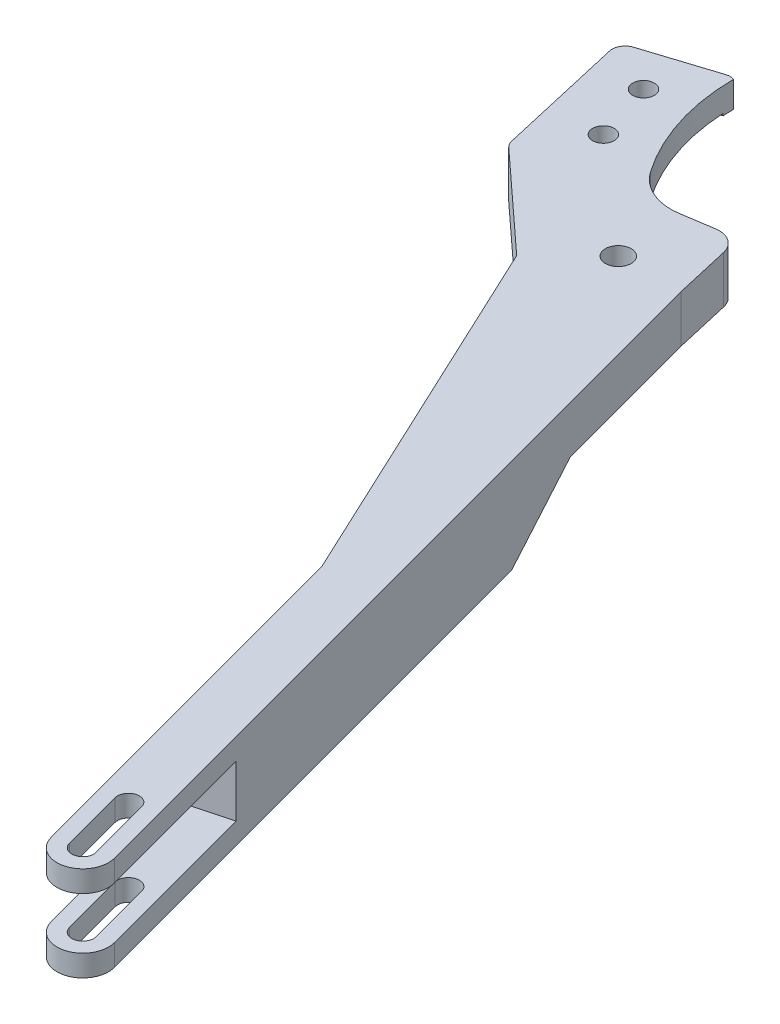
from build123d import *
from build123d.topology import SkipClean

# Parameters (mm, degrees)
SKETCH1_R              = 2.5
SKETCH1_R_2            = 3
BOSS_EXTRUDE1_DEPTH    = 11
BOSS_EXTRUDE2_START    = 11
BOSS_EXTRUDE2_DEPTH    = 11
CUT_EXTRUDE8_START     = -5.42
CUT_EXTRUDE8_OUTLINE_R = 2.5
CUT_EXTRUDE8_DEPTH     = 5.42
CUT_EXTRUDE9_DEPTH     = 200.464537277
SKETCH22_W             = 1.692224542
SKETCH22_H             = 1
BOSS_EXTRUDE5_DEPTH    = 5.58
BOSS_EXTRUDE6_START    = 0.5
BOSS_EXTRUDE6_DEPTH    = 0.5
CUT_EXTRUDE11_START    = -5
CUT_EXTRUDE11_DEPTH    = 12
CUT_EXTRUDE12_DEPTH    = 11


# Read off the part's stored shape, not the designer's step: Cut-Extrude8
with BuildPart() as part:
    # Sketch1 → Boss-Extrude1 (new body)
    with BuildSketch(Plane(origin=(0, 0, 0), x_dir=(1, 0, 0), z_dir=(0, 1, 0))):
        with BuildLine():
            Line((-24.065911245, 49.074379963), (-40.33748217, 43.862823975))
            ThreePointArc((-40.33748217, 43.862823975), (-42.029254381, 42.490505115), (-42.346540309, 40.335352706))
            Line((-42.346540309, 40.335352706), (-35.554744394, 10.712738062))
            ThreePointArc((-35.554744394, 10.712738062), (-35.224207157, 9.875429138), (-34.660148596, 9.173874408))
            Line((-34.660148596, 9.173874408), (-11.926083617, -11.710336344))
            Line((-11.926083617, -11.710336344), (28.105920068, -97.151333217))
            Line((28.105920068, -97.151333217), (51.127586716, -183.069362819))
            ThreePointArc((51.127586716, -183.069362819), (58.476055497, -187.312004338), (62.718696966, -179.963535528))
            Line((62.718696966, -179.963535528), (14.478423579, 0.071615722))
            Line((14.478423579, 0.071615722), (11.515517153, 12.994417934))
            ThreePointArc((11.515517153, 12.994417934), (9.45213952, 16.012597514), (5.886229377, 16.819579599))
            Line((5.886229377, 16.819579599), (-1.513417826, 15.688133083))
            ThreePointArc((-1.513417826, 15.688133083), (-8.06952351, 16.520767077), (-13.198183321, 20.688818137))
            ThreePointArc((-13.198183321, 20.688818137), (-19.873214701, 34.19205636), (-22.223775344, 49.070508937))
            ThreePointArc((-22.223775344, 49.070508937), (-23.144538818, 49.217338163), (-24.065911245, 49.074379963))
        make_face()
        with BuildLine():
            ThreePointArc((59.386252708, -180.856460648), (57.583130416, -183.97956007), (54.460030994, -182.176437778))
            Line((54.460030994, -182.176437778), (50.577745318, -167.687550384))
            ThreePointArc((50.577745318, -167.687550384), (52.38086761, -164.564450962), (55.503967032, -166.367573254))
            Line((55.503967032, -166.367573254), (59.386252708, -180.856460648))
        make_face(mode=Mode.SUBTRACT)
        with Locations(Location((-26.231262377, 22.76176979, 0), (0, 0, 270))):
            Circle(SKETCH1_R, mode=Mode.SUBTRACT)
        with BuildLine():
            Line((-32.594396249, 32.813795701), (-31.813835797, 32.992760568))
            ThreePointArc((-31.813835797, 32.992760568), (-32.198538906, 32.878953378), (-32.594396249, 32.813795701))
        make_face(mode=Mode.SUBTRACT)
        with Locations(Location((-30.69116896, 36.558843149, 0), (0, 0, 270))):
            Circle(SKETCH1_R, mode=Mode.SUBTRACT)
        with Locations(Location((0, 0, 0), (0, 0, 270))):
            Circle(SKETCH1_R_2, mode=Mode.SUBTRACT)
    extrude(amount=BOSS_EXTRUDE1_DEPTH)

    # Sketch15 → Boss-Extrude2 (add)
    with SkipClean():  # the faces are left unmerged after this step: merging them gives an invalid solid
        with BuildSketch(Plane.XZ.offset(BOSS_EXTRUDE2_START)):
            with BuildLine():
                ThreePointArc((62.718696809, 179.963534942), (60.986991622, 177.102253359), (57.992587901, 175.612528046))
                Line((57.992587901, 175.612528046), (55.514643215, 166.364712579))
                ThreePointArc((55.514643215, 166.364712579), (52.378006935, 164.553774778), (50.567069134, 167.690411058))
                Line((50.567069134, 167.690411058), (53.04501382, 176.938226526))
                ThreePointArc((53.04501382, 176.938226526), (51.196646785, 179.725568352), (51.127586894, 183.069363484))
                Line((51.127586894, 183.069363484), (28.105920068, 97.151333217))
                Line((28.105920068, 97.151333217), (12.304730128, 38.18048954))
                Line((12.304730128, 38.18048954), (23.895840044, 35.074660999))
                Line((23.895840044, 35.074660999), (62.718696809, 179.963534942))
            make_face()
            with BuildLine():
                ThreePointArc((54.449354811, 182.179298453), (57.585991091, 183.990236254), (59.396928892, 180.853599973))
                Line((59.396928892, 180.853599973), (57.992587901, 175.612528046))
                ThreePointArc((57.992587901, 175.612528046), (60.986991622, 177.102253359), (62.718696809, 179.963534942))
                ThreePointArc((62.718696809, 179.963534942), (62.87181102, 180.73329206), (62.923141851, 181.516449213))
                ThreePointArc((62.923141851, 181.516449213), (57.706299005, 187.465118381), (51.127586894, 183.069363484))
                ThreePointArc((51.127586894, 183.069363484), (51.196646785, 179.725568352), (53.04501382, 176.938226526))
                Line((53.04501382, 176.938226526), (54.449354811, 182.179298453))
            make_face()
        extrude(amount=-BOSS_EXTRUDE2_DEPTH)

    # Cut-Extrude8 outline → Cut-Extrude8 (cut)
    with SkipClean():  # the faces are left unmerged after this step: merging them gives an invalid solid
        with BuildSketch(Plane.XZ.offset(CUT_EXTRUDE8_START)):
            with BuildLine():
                Line((7.440475273, -16.812852061), (5.096097174, -11.765824195))
                ThreePointArc((5.096097174, -11.765824195), (0.648562626, -11.588913559), (-3.406606041, -13.423979773))
                Line((-3.406606041, -13.423979773), (-22.492177879, -12.118359456))
                ThreePointArc((-22.492177879, -12.118359456), (-26.84408445, -13.271868588), (-29.593378831, -16.837125174))
                Line((-29.593378831, -16.837125174), (-38.983226386, -44.296573112))
                Line((-38.983226386, -44.296573112), (-24.065911245, -49.074379963))
                ThreePointArc((-24.065911245, -49.074379963), (-23.144538818, -49.217338163), (-22.223775344, -49.070508937))
                ThreePointArc((-22.223775344, -49.070508937), (-19.873214666, -34.19205625), (-13.198183188, -20.688817948))
                ThreePointArc((-13.198183188, -20.688817948), (-8.069523818, -16.520767209), (-1.513418717, -15.688132947))
                Line((-1.513418717, -15.688132947), (5.886229377, -16.819579599))
                ThreePointArc((5.886229377, -16.819579599), (6.663615332, -16.876977606), (7.440475273, -16.812852061))
            make_face()
            with Locations((-30.69116896, -36.558843149)):
                Circle(CUT_EXTRUDE8_OUTLINE_R, mode=Mode.SUBTRACT)
            with BuildLine():
                Line((-31.813835797, -32.992760568), (-32.594396249, -32.813795701))
                ThreePointArc((-32.594396249, -32.813795701), (-32.198538906, -32.878953378), (-31.813835797, -32.992760568))
            make_face(mode=Mode.SUBTRACT)
            with Locations((-26.231262377, -22.76176979)):
                Circle(CUT_EXTRUDE8_OUTLINE_R, mode=Mode.SUBTRACT)
        extrude(amount=CUT_EXTRUDE8_DEPTH, mode=Mode.SUBTRACT)

    # Sketch19 → Cut-Extrude9 (cut, through all)
    with SkipClean():  # the faces are left unmerged after this step: merging them gives an invalid solid
        with BuildSketch(Plane(origin=(13.526457033, 0, -3.624403239), x_dir=(-0.2588190451025201, 0, -0.9659258262890685), z_dir=(0.9659258262890686, 0, -0.2588190451025201))):
            Polygon((-59.369639824, -11), (-40.064219409, 0), (-40.064219409, -11), align=None)
        extrude(amount=-CUT_EXTRUDE9_DEPTH, mode=Mode.SUBTRACT)

    # Sketch22 → Boss-Extrude5 (add, through all)
    with SkipClean():  # the faces are left unmerged after this step: merging them gives an invalid solid
        with BuildSketch(Plane.XZ.offset(-5.42)):
            with Locations((-32.253882585, -32.818926128)):
                Rectangle(SKETCH22_W, SKETCH22_H)
        extrude(amount=-BOSS_EXTRUDE5_DEPTH)

    # Sketch23 → Boss-Extrude6 (add)
    with SkipClean():  # the faces are left unmerged after this step: merging them gives an invalid solid
        with BuildSketch(Plane.XZ.offset(-5.42).offset(BOSS_EXTRUDE6_START)):
            with BuildLine():
                Line((-26.008052503, -45.302821126), (-38.012549647, -41.457949032))
                Line((-38.012549647, -41.457949032), (-38.983226386, -44.296573112))
                Line((-38.983226386, -44.296573112), (-24.065911245, -49.074379963))
                ThreePointArc((-24.065911245, -49.074379963), (-25.817991998, -47.590776952), (-26.008052503, -45.302821126))
            make_face()
            with BuildLine():
                Line((-22.14579331, -46.539848584), (-26.008052503, -45.302821126))
                ThreePointArc((-26.008052503, -45.302821126), (-25.817991998, -47.590776952), (-24.065911245, -49.074379963))
                ThreePointArc((-24.065911245, -49.074379963), (-23.144538818, -49.217338163), (-22.223775344, -49.070508937))
                ThreePointArc((-22.223775344, -49.070508937), (-22.200805099, -47.804685082), (-22.14579331, -46.539848584))
            make_face()
        extrude(amount=-BOSS_EXTRUDE6_DEPTH)

    # Sketch26 → Cut-Extrude11 (cut)
    with BuildSketch(Plane.XZ.offset(11).offset(CUT_EXTRUDE11_START)):
        Polygon((184.237099145, 679.840826179), (51.127586894, 183.069363484), (40.774825089, 144.432330432), (52.365935005, 141.326501891), (62.718696809, 179.963534942), (195.828209061, 676.734997637), (462.047233565, 1670.277923027), (450.456123649, 1673.383751569), align=None)
    extrude(amount=-CUT_EXTRUDE11_DEPTH, mode=Mode.SUBTRACT)

    # Sketch27 → Cut-Extrude12 (cut)
    with BuildSketch(Plane.XZ.offset(11)):
        Polygon((12.304730128, 38.18048954), (16.187015805, 52.669376935), (16.168433433, 37.14521336), align=None)
    extrude(amount=-CUT_EXTRUDE12_DEPTH, mode=Mode.SUBTRACT)


solid = part.part
